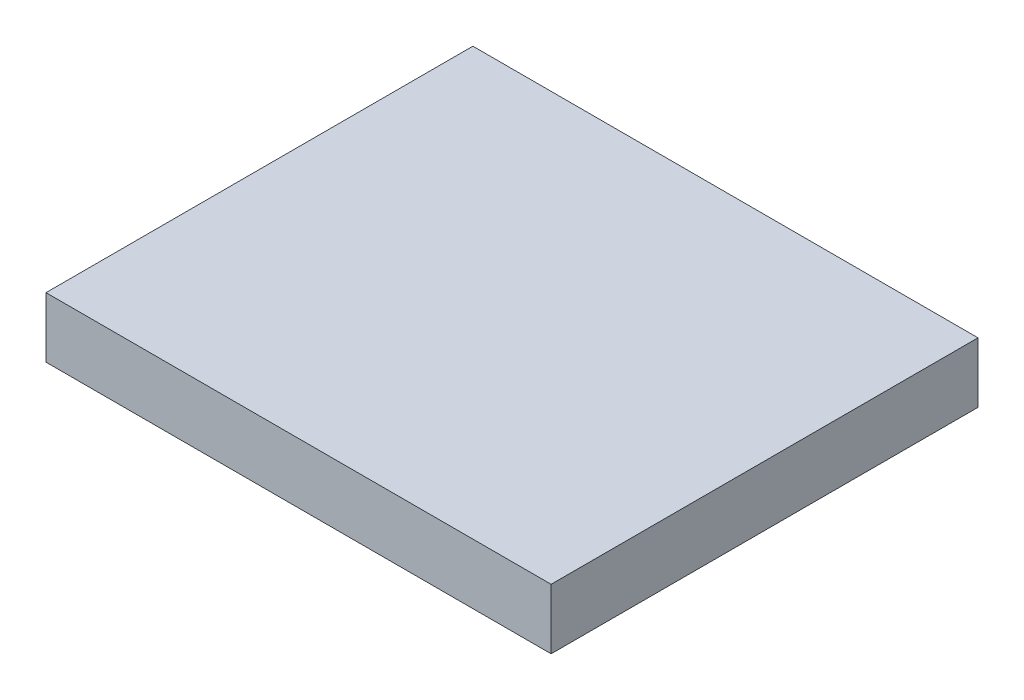
from build123d import *

# Parameters (mm, degrees)
BOSS_EXTRUDE1_DEPTH      = 776
BOSS_EXTRUDE1_DEPTH_BACK = 592
SKETCH1_W                = 1156.126069877
SKETCH1_H                = 163.121844074


with BuildPart() as part:
    # Sketch1 → Boss-Extrude1 (new, two sides: drawn at the far end of the back side and taken through both)
    with BuildSketch(Plane(origin=(-6.949111765, -0.000555745, -100.47405685), x_dir=(0, 0, -1), z_dir=(1, 0, 0)).offset(-BOSS_EXTRUDE1_DEPTH_BACK)):
        with Locations((-109.558471861, 244.964930534)):
            Rectangle(SKETCH1_W, SKETCH1_H)
    extrude(amount=BOSS_EXTRUDE1_DEPTH + BOSS_EXTRUDE1_DEPTH_BACK)


solid = part.part
